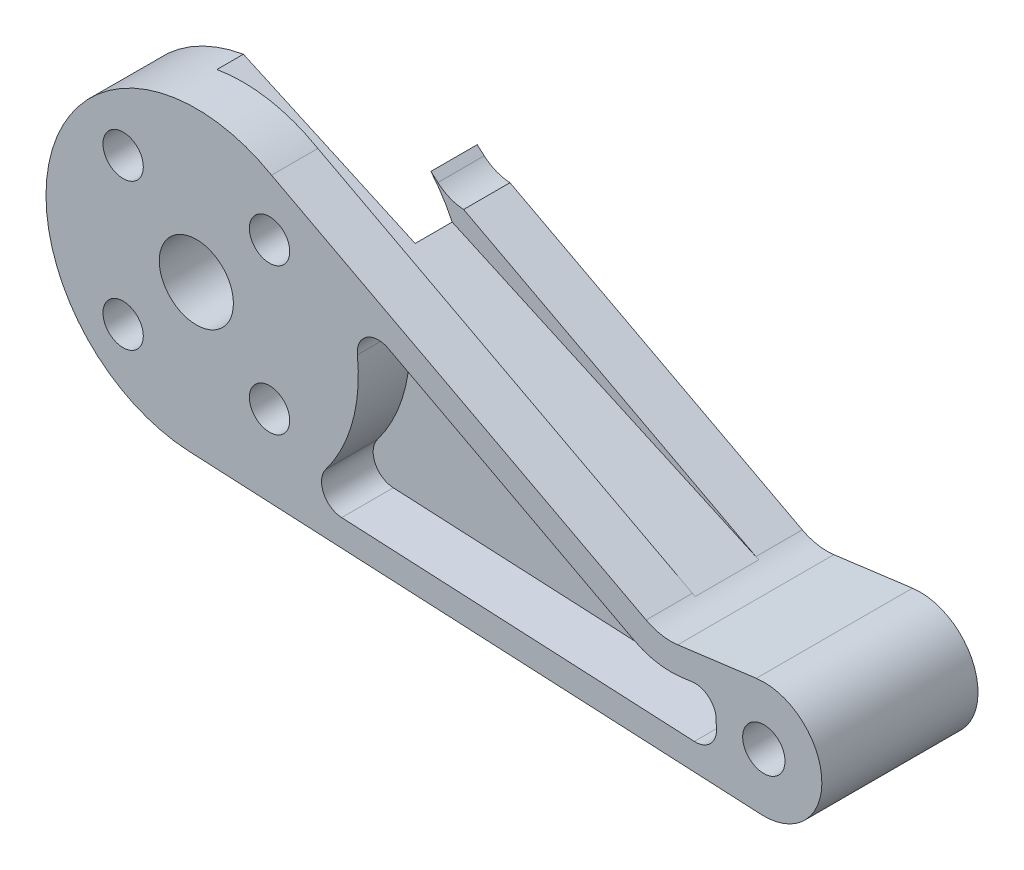
from build123d import *

# Parameters (mm, degrees)
BOSS_EXTRUDE1_DEPTH                     = 15
F_4_0_4_DIAMETER_HOLE1_D                = 4
CBORE_FOR_M6_HEX_HEAD_BOLT1_D           = 7
CBORE_FOR_M6_HEX_HEAD_BOLT1_CBORE_D     = 25.6
CBORE_FOR_M6_HEX_HEAD_BOLT1_CBORE_DEPTH = 3
SHELL1_DEPTH                            = 5
CUT_EXTRUDE4_START                      = 5
CUT_EXTRUDE4_DEPTH                      = 5
CUT_EXTRUDE5_DEPTH                      = 3
CUT_EXTRUDE5_DEPTH_BACK                 = 3
SKETCH23_R                              = 5
CUT_EXTRUDE6_DEPTH                      = 67.110950493
CUT_EXTRUDE6_DEPTH_BACK                 = 3
FILLET1_R                               = 2
SKETCH30_W                              = 87.8922038
SKETCH30_H                              = 63.386693804
CUT_EXTRUDE8_DEPTH                      = 0.125
SKETCH31_W                              = 82.344977649
SKETCH31_H                              = 39.024548637
CUT_EXTRUDE9_DEPTH                      = 0.125
SKETCH38_R                              = 1.905
CUT_EXTRUDE10_DEPTH                     = 68.319909946
SKETCH39_R                              = 15.3
CUT_EXTRUDE11_DEPTH                     = 7.875


# Read off the part's stored shape, not the designer's step: Shell1
with BuildPart() as part:
    # Sketch1 → Boss-Extrude1 (new body)
    with BuildSketch(Plane(origin=(0, 0, 0), x_dir=(-1, 0, 0), z_dir=(0, 0, -1))):
        with BuildLine():
            Line((-54.628463331, -5.212133486), (-0.593380164, -2.525889334))
            ThreePointArc((-0.593380164, -2.525889334), (12.32206912, 15.671805741), (-8.399323253, 23.953643362))
            Line((-8.399323253, 23.953643362), (-43.781031906, 5.260553383))
            ThreePointArc((-43.781031906, 5.260553383), (-45.231601083, 4.760443022), (-46.765522471, 4.723748524))
            Line((-46.765522471, 4.723748524), (-54.189447973, 5.695292216))
            ThreePointArc((-54.189447973, 5.695292216), (-60.376392814, 0.481764046), (-54.628463331, -5.212133486))
        make_face()
    extrude(amount=-BOSS_EXTRUDE1_DEPTH)

    # Ø4.0 (4) Diameter Hole1 (through all)
    with Locations(Plane(origin=(0, 0, 0), x_dir=(-1, 0, 0), z_dir=(0, 0, -1))):
        with Locations((-54.900567232, 0.261366347)):
            Hole(F_4_0_4_DIAMETER_HOLE1_D / 2)

    # CBORE for M6 Hex Head Bolt1 (through all)
    with Locations(Plane(origin=(0, 0, 0), x_dir=(-1, 0, 0), z_dir=(0, 0, -1))):
        with Locations((-1.298433566, 11.656596333)):
            CounterBoreHole(CBORE_FOR_M6_HEX_HEAD_BOLT1_D / 2, CBORE_FOR_M6_HEX_HEAD_BOLT1_CBORE_D / 2, CBORE_FOR_M6_HEX_HEAD_BOLT1_CBORE_DEPTH)

    # Shell1 outline → Shell1 (cut)
    with BuildSketch(Plane.XY):
        with BuildLine():
            Line((51.170699652, 2.778922273), (47.089922847, 2.244884995))
            ThreePointArc((47.089922847, 2.244884995), (44.789040765, 2.299926742), (42.613186999, 3.050092283))
            Line((42.613186999, 3.050092283), (15.48696558, 17.381590594))
            ThreePointArc((15.48696558, 17.381590594), (16.050757412, 7.599634274), (10.564355185, -0.518488741))
            Line((10.564355185, -0.518488741), (51.385096413, -2.547808785))
            ThreePointArc((51.385096413, -2.547808785), (50.404207808, 0.080391395), (51.170699652, 2.778922273))
        make_face()
    extrude(amount=SHELL1_DEPTH, mode=Mode.SUBTRACT)

    # Sketch21 → Cut-Extrude4 (cut)
    with BuildSketch(Plane(origin=(0, 0, 15), x_dir=(-1, 0, 0), z_dir=(0, 0, -1)).offset(CUT_EXTRUDE4_START)):
        with BuildLine():
            Line((-51.170699652, 2.778922273), (-47.089922847, 2.244884995))
            ThreePointArc((-47.089922847, 2.244884995), (-44.789040765, 2.299926742), (-42.613186999, 3.050092283))
            Line((-42.613186999, 3.050092283), (-15.48696558, 17.381590594))
            ThreePointArc((-15.48696558, 17.381590594), (-16.050757412, 7.599634274), (-10.564355185, -0.518488741))
            Line((-10.564355185, -0.518488741), (-51.385096413, -2.547808785))
            ThreePointArc((-51.385096413, -2.547808785), (-50.404207808, 0.080391395), (-51.170699652, 2.778922273))
        make_face()
    extrude(amount=-CUT_EXTRUDE4_DEPTH, mode=Mode.SUBTRACT)

    # Sketch23 → Cut-Extrude5 (cut, two sides: drawn at the far end of the back side and taken through both)
    with BuildSketch(Plane(origin=(0, 0, 7.5), x_dir=(-1, 0, 0), z_dir=(0, 0, -1)).offset(-CUT_EXTRUDE5_DEPTH_BACK)):
        with Locations((-65.267572651, 7.904637809)):
            Circle(SKETCH23_R)
        Polygon((2.769070011, 26.390627774), (-44.049268023, 5.128933961), (-46.116721719, 9.681475582), (0.701616314, 30.943169395), align=None)
    extrude(amount=CUT_EXTRUDE5_DEPTH + CUT_EXTRUDE5_DEPTH_BACK, mode=Mode.SUBTRACT)

    # Sketch24 → Cut-Extrude6 (cut, two sides: drawn at the far end of the back side and taken through both)
    with BuildSketch(Plane(origin=(0, 0, 7.5), x_dir=(-1, 0, 0), z_dir=(0, 0, -1)).offset(-CUT_EXTRUDE6_DEPTH_BACK)):
        with BuildLine():
            Line((-9.027257312, 24.978582277), (-13.74014268, 20.838163554))
            ThreePointArc((-13.74014268, 20.838163554), (-20.357630392, 23.419198741), (-14.432959892, 27.337255112))
            Line((-14.432959892, 27.337255112), (-9.027257312, 24.978582277))
        make_face()
    extrude(amount=CUT_EXTRUDE6_DEPTH + CUT_EXTRUDE6_DEPTH_BACK, mode=Mode.SUBTRACT)

    # Fillet1
    fillet1_edges = [part.edges().sort_by_distance(p)[0] for p in [
        (10.564355185, -0.518488741, 2.5),
        (51.170699652, 2.778922273, 2.5),
        (51.385096413, -2.547808785, 2.5),
        (15.48696558, 17.381590594, 2.5),
        (51.170699652, 2.778922273, 12.5),
        (51.385096413, -2.547808785, 12.5),
        (10.564355185, -0.518488741, 12.5),
        (15.48696558, 17.381590594, 12.5),
    ]]
    fillet(fillet1_edges, radius=FILLET1_R)

    # Sketch30 → Cut-Extrude8 (cut)
    with BuildSketch(Plane.XY.offset(15)):
        with Locations((24.760370948, 9.451685766)):
            Rectangle(SKETCH30_W, SKETCH30_H)
    extrude(amount=-CUT_EXTRUDE8_DEPTH, mode=Mode.SUBTRACT)

    # Sketch31 → Cut-Extrude9 (cut)
    with BuildSketch(Plane(origin=(0, 0, 0), x_dir=(-1, 0, 0), z_dir=(0, 0, -1))):
        with Locations((-23.438477607, 10.614160855)):
            Rectangle(SKETCH31_W, SKETCH31_H)
    extrude(amount=-CUT_EXTRUDE9_DEPTH, mode=Mode.SUBTRACT)

    # Sketch38 → Cut-Extrude10 (cut, through all)
    with BuildSketch(Plane.XY.offset(14.875)):
        with Locations((-5.615950455, 18.571806714)):
            Circle(SKETCH38_R)
        with Locations((8.213643947, 18.570980353)):
            Circle(SKETCH38_R)
        with Locations((8.212817586, 4.741385951)):
            Circle(SKETCH38_R)
        with Locations((-5.616776816, 4.742212313)):
            Circle(SKETCH38_R)
    extrude(amount=-CUT_EXTRUDE10_DEPTH, mode=Mode.SUBTRACT)

    # Sketch39 → Cut-Extrude11 (cut)
    with BuildSketch(Plane(origin=(0, 0, 0.125), x_dir=(-1, 0, 0), z_dir=(0, 0, -1))):
        with Locations((-1.298433566, 11.656596333)):
            Circle(SKETCH39_R)
    extrude(amount=-CUT_EXTRUDE11_DEPTH, mode=Mode.SUBTRACT)


solid = part.part
